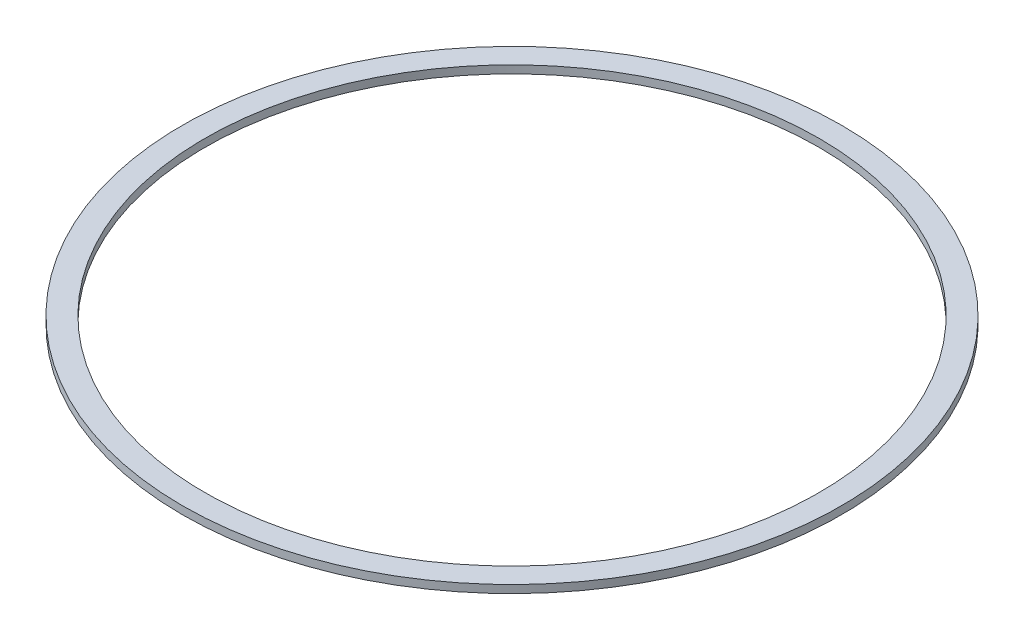
from build123d import *

# Parameters (mm, degrees)
SKETCH1_W = 7.5
SKETCH1_H = 2.61


with BuildPart() as part:
    # Sketch1 → Revolve1 (revolve)
    with BuildSketch(Plane.XY):
        with Locations((-105.75, 4.48)):
            Rectangle(SKETCH1_W, SKETCH1_H)
    revolve(axis=Axis((0, -200069.047495165, 0), (0, 1, 0)))


solid = part.part
